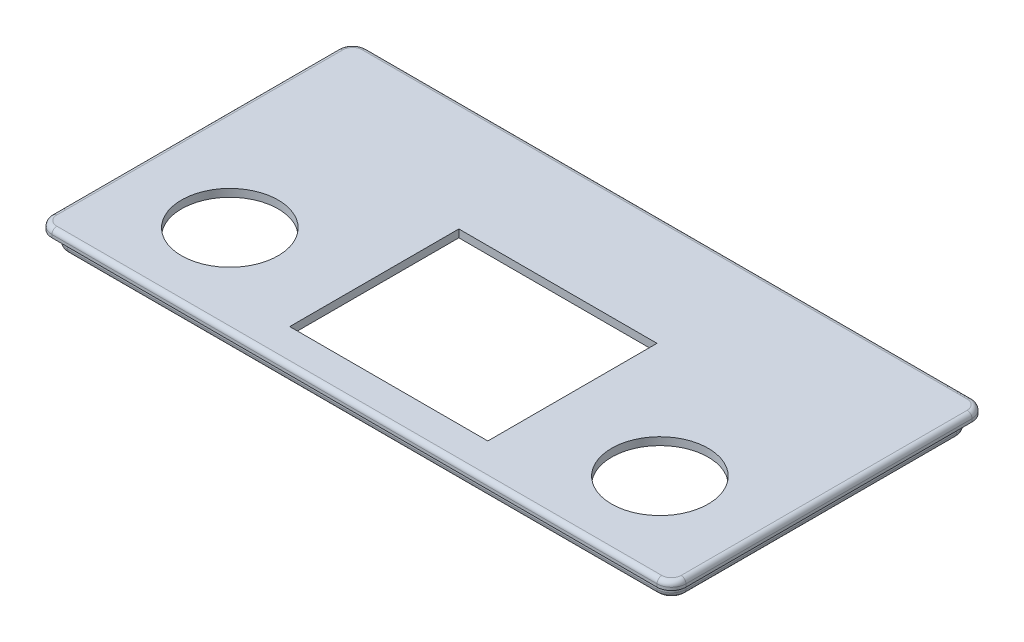
from build123d import *

# Parameters (mm, degrees)
SKETCH1_W           = 128
SKETCH1_H           = 62
SKETCH1_W_2         = 124.8
SKETCH1_H_2         = 58.8
BOSS_EXTRUDE1_DEPTH = 3
SKETCH3_W           = 131.2
SKETCH3_H           = 65.2
BOSS_EXTRUDE3_DEPTH = 1.6
FILLET2_R           = 3
CUT_EXTRUDE1_REACH  = 75.398
SKETCH4_R           = 10
FILLET3_R           = 1
FILLET4_R           = 1
CUT_EXTRUDE2_REACH  = 75.398
SKETCH5_W           = 41
SKETCH5_H           = 35


with BuildPart() as part:
    # Sketch1 → Boss-Extrude1 (new body)
    with BuildSketch(Plane(origin=(0, 0, 0), x_dir=(1, 0, 0), z_dir=(0, 1, 0))):
        Rectangle(SKETCH1_W, SKETCH1_H)
        Rectangle(SKETCH1_W_2, SKETCH1_H_2, mode=Mode.SUBTRACT)
    extrude(amount=BOSS_EXTRUDE1_DEPTH)

    # Sketch3 → Boss-Extrude3 (add)
    with BuildSketch(Plane(origin=(0, 3, 0), x_dir=(1, 0, 0), z_dir=(0, 1, 0))):
        Rectangle(SKETCH3_W, SKETCH3_H)
    extrude(amount=BOSS_EXTRUDE3_DEPTH)

    # Fillet2
    fillet2_edges = [part.edges().sort_by_distance(p)[0] for p in [
        (-62.4, 1.5, 29.4),
        (-62.4, 1.5, -29.4),
        (62.4, 1.5, -29.4),
        (62.4, 1.5, 29.4),
        (64, 1.5, -31),
        (65.6, 3.8, -32.6),
        (65.6, 3.8, 32.6),
        (64, 1.5, 31),
        (-64, 1.5, -31),
        (-65.6, 3.8, -32.6),
        (-65.6, 3.8, 32.6),
        (-64, 1.5, 31),
    ]]
    fillet(fillet2_edges, radius=FILLET2_R)

    # Sketch4 → Cut-Extrude1 (cut, up to next)
    with BuildSketch(Plane(origin=(0, 4.6, 0), x_dir=(1, 0, 0), z_dir=(0, 1, 0)), mode=Mode.PRIVATE) as cut_extrude1_sk1:
        with Locations((-44.3929, -14)):
            Circle(SKETCH4_R)
    cut_extrude1_tool1 = extrude(cut_extrude1_sk1.sketch, amount=-CUT_EXTRUDE1_REACH, mode=Mode.PRIVATE) & part.part
    # Sketch4 → Cut-Extrude1 (cut, up to next)
    with BuildSketch(Plane(origin=(0, 4.6, 0), x_dir=(1, 0, 0), z_dir=(0, 1, 0)), mode=Mode.PRIVATE) as cut_extrude1_sk2:
        with Locations((44.6071, -14)):
            Circle(SKETCH4_R)
    cut_extrude1_tool2 = extrude(cut_extrude1_sk2.sketch, amount=-CUT_EXTRUDE1_REACH, mode=Mode.PRIVATE) & part.part
    add(cut_extrude1_tool1.solids().sort_by_distance((-44.3929, 4.6, 14))[0], mode=Mode.SUBTRACT)
    add(cut_extrude1_tool2.solids().sort_by_distance((44.6071, 4.6, 14))[0], mode=Mode.SUBTRACT)

    # Fillet3
    fillet3_edges = [part.edges().sort_by_distance(p)[0] for p in [
        (64.721320344, 4.6, -31.721320344),
        (65.6, 4.6, 0),
        (64.721320344, 4.6, 31.721320344),
        (0, 4.6, 32.6),
        (-64.721320344, 4.6, 31.721320344),
        (-65.6, 4.6, 0),
        (-64.721320344, 4.6, -31.721320344),
        (0, 4.6, -32.6),
    ]]
    fillet(fillet3_edges, radius=FILLET3_R)

    # Fillet4
    fillet4_edges = [part.edges().sort_by_distance(p)[0] for p in [
        (-63.121320344, 0, 30.121320344),
        (-64, 0, 0),
        (-63.121320344, 0, -30.121320344),
        (0, 0, -31),
        (63.121320344, 0, -30.121320344),
        (64, 0, 0),
        (63.121320344, 0, 30.121320344),
        (0, 0, 31),
    ]]
    fillet(fillet4_edges, radius=FILLET4_R)

    # Sketch5 → Cut-Extrude2 (cut, up to next)
    with BuildSketch(Plane(origin=(0, 4.6, 0), x_dir=(1, 0, 0), z_dir=(0, 1, 0)), mode=Mode.PRIVATE) as cut_extrude2_sk1:
        with Locations((0, -8)):
            Rectangle(SKETCH5_W, SKETCH5_H)
    cut_extrude2_tool1 = extrude(cut_extrude2_sk1.sketch, amount=-CUT_EXTRUDE2_REACH, mode=Mode.PRIVATE) & part.part
    add(cut_extrude2_tool1.solids().sort_by_distance((0, 4.6, 8))[0], mode=Mode.SUBTRACT)


solid = part.part
